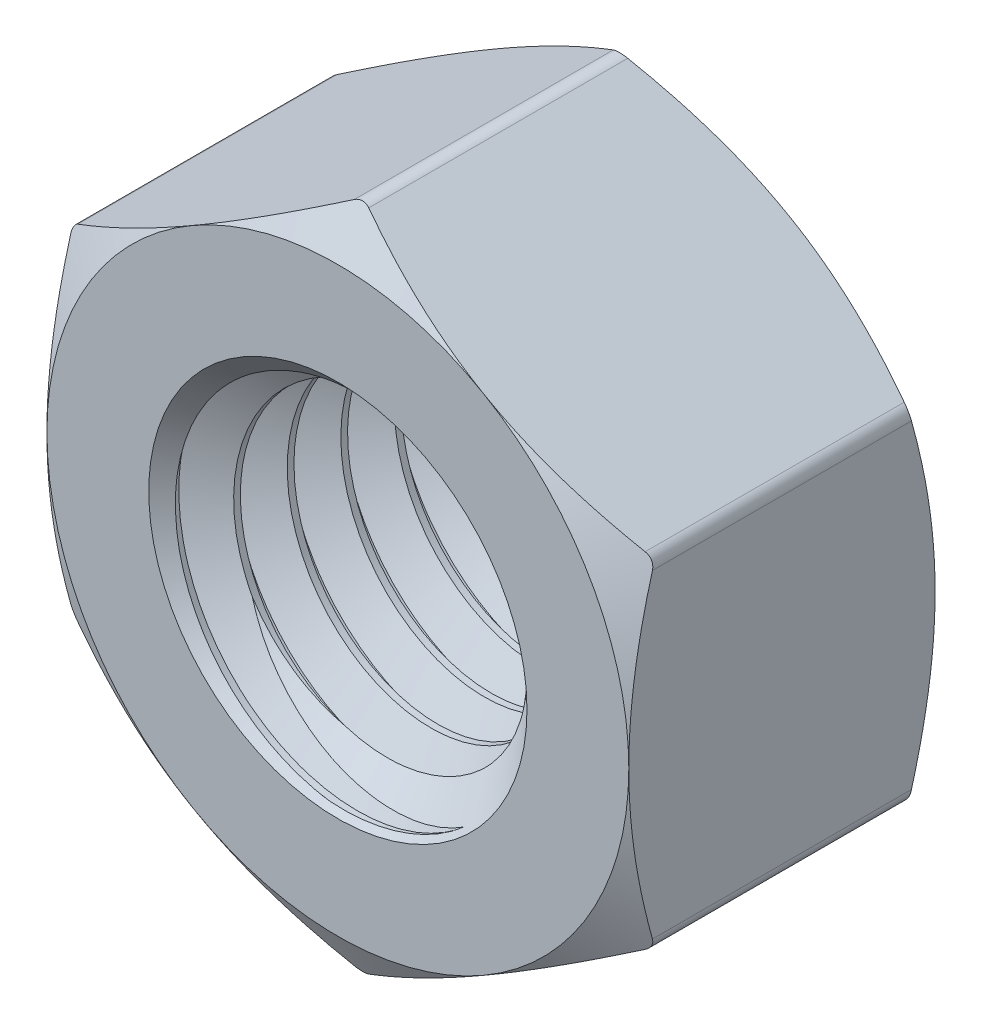
from build123d import *

# Parameters (mm, degrees)
BOSS_EXTRUDE2_DEPTH     = 5
CUT_EXTRUDE4_DEPTH      = 16.34872416
CUT_EXTRUDE4_DEPTH_BACK = 16.34872416
SKETCH16_R              = 6
SKETCH7_OUTSIDE_W       = 91.652
SKETCH7_OUTSIDE_H       = 94.592
SKETCH7_OUTSIDE_R       = 9.5
CUT_EXTRUDE5_DEPTH      = 18.62337463
CUT_EXTRUDE5_DRAFT      = -60
MIRROR4_COPY_1_SKETCH_W = 91.652
MIRROR4_COPY_1_SKETCH_H = 94.592
MIRROR4_COPY_1_SKETCH_R = 9.5
MIRROR4_COPY_1_DEPTH    = 18.62337463
MIRROR4_COPY_1_DRAFT    = -60
FILLET2_R               = 0.475
SKETCH13_R              = 6
BOSS_EXTRUDE1_DEPTH     = 10
CUT_SWEEP1_PITCH        = 1.75
SKETCH17_R              = 6
BOSS_EXTRUDE3_DEPTH     = 10


with BuildPart() as part:
    # Sketch15 → Boss-Extrude2 (new, symmetric)
    with BuildSketch(Plane.XY):
        Polygon((0, 10.969655115), (-9.5, 5.484827557), (-9.5, -5.484827557), (0, -10.969655115), (9.5, -5.484827557), (9.5, 5.484827557), align=None)
    extrude(amount=BOSS_EXTRUDE2_DEPTH, both=True)

    # Sketch16 → Cut-Extrude4 (cut, two sides: drawn at the far end of the back side and taken through both)
    with BuildSketch(Plane.XY.offset(-CUT_EXTRUDE4_DEPTH_BACK)):
        Circle(SKETCH16_R)
    extrude(amount=CUT_EXTRUDE4_DEPTH + CUT_EXTRUDE4_DEPTH_BACK, mode=Mode.SUBTRACT)


with BuildPart() as cut_extrude5_tool:
    # Sketch7 outside → Cut-Extrude5 (with draft: the straight prism first)
    with BuildSketch(Plane.XY.offset(5)):
        Rectangle(SKETCH7_OUTSIDE_W, SKETCH7_OUTSIDE_H)
        Circle(SKETCH7_OUTSIDE_R, mode=Mode.SUBTRACT)
    extrude(amount=-CUT_EXTRUDE5_DEPTH)
    # Cut-Extrude5: the draft: its side faces are tilted about the plane it starts from
    cut_extrude5_sides = [cut_extrude5_tool.faces().sort_by_distance(p)[0] for p in [
        (0, -47.296, -4.311687315),
        (45.826, 0, -4.311687315),
        (0, 47.296, -4.311687315),
        (-45.826, 0, -4.311687315),
        (-9.5, 0, -4.311687315),
    ]]
    draft(cut_extrude5_sides, Plane.XY.offset(5), CUT_EXTRUDE5_DRAFT)


with BuildPart() as part_1:
    add(part.part)

    # Cut-Extrude5: cut by cut_extrude5_tool
    add(cut_extrude5_tool.part, mode=Mode.SUBTRACT)


with BuildPart() as mirror4_copy_1_tool:
    # Mirror4 copy 1 sketch → Mirror4 copy 1 (with draft: the straight prism first)
    with BuildSketch(Plane(origin=(0, 0, -5), x_dir=(1, 0, 0), z_dir=(0, 0, -1))):
        Rectangle(MIRROR4_COPY_1_SKETCH_W, MIRROR4_COPY_1_SKETCH_H)
        Circle(MIRROR4_COPY_1_SKETCH_R, mode=Mode.SUBTRACT)
    extrude(amount=-MIRROR4_COPY_1_DEPTH)
    # Mirror4 copy 1: the draft: its side faces are tilted about the plane it starts from
    mirror4_copy_1_sides = [mirror4_copy_1_tool.faces().sort_by_distance(p)[0] for p in [
        (0, -47.296, 4.311687315),
        (45.826, 0, 4.311687315),
        (0, 47.296, 4.311687315),
        (-45.826, 0, 4.311687315),
        (-9.5, 0, 4.311687315),
    ]]
    draft(mirror4_copy_1_sides, Plane(origin=(0, 0, -5), x_dir=(1, 0, 0), z_dir=(0, 0, -1)), MIRROR4_COPY_1_DRAFT)


with BuildPart() as part_2:
    add(part_1.part)

    # Mirror4 copy 1: cut by mirror4_copy_1_tool
    add(mirror4_copy_1_tool.part, mode=Mode.SUBTRACT)

    # Fillet2
    fillet2_edges = [part_2.edges().sort_by_distance(p)[0] for p in [
        (-9.5, 5.484827557, 0),
        (-9.5, -5.484827557, 0),
        (0, -10.969655115, 0),
        (9.5, -5.484827557, 0),
        (9.5, 5.484827557, 0),
        (0, 10.969655115, 0),
    ]]
    fillet(fillet2_edges, radius=FILLET2_R)

    # Sketch17 → Boss-Extrude3 (add)
    with BuildSketch(Plane.XY.offset(5)):
        Circle(SKETCH17_R)
    extrude(amount=-BOSS_EXTRUDE3_DEPTH)


with BuildPart() as body_2:
    # Sketch13 → Boss-Extrude1 (new body)
    with BuildSketch(Plane(origin=(0, 0, -5), x_dir=(-1, 0, 0), z_dir=(0, 0, -1))):
        Circle(SKETCH13_R)
    extrude(amount=-BOSS_EXTRUDE1_DEPTH)

    # Cut-Sweep1: the profile of Sketch12 profile screwed along a right-hand helix of 7.714286 turns, 10 arcs to a turn; built about Z, then put on its axis
    cut_sweep1_z = Axis((0, 0, 0), (0, 0, 1))
    cut_sweep1_corners = [(6.0003, 0, -1.531423205), (6.0003, 0, 0.000173205), (4.863341658, 0, -0.65625), (4.863341658, 0, -0.875)]
    with BuildLine(mode=Mode.PRIVATE) as cut_sweep1_profile:
        Line(cut_sweep1_corners[0], cut_sweep1_corners[1])
        Line(cut_sweep1_corners[1], cut_sweep1_corners[2])
        Line(cut_sweep1_corners[2], cut_sweep1_corners[3])
        Line(cut_sweep1_corners[3], cut_sweep1_corners[0])
    cut_sweep1_cap = Face(cut_sweep1_profile.wire())
    cut_sweep1_turn_angles = [0, 18, 36, 54, 72, 90, 108, 126, 144, 162, 180, 198, 216, 234, 252, 270, 288, 306, 324, 342, 360]
    cut_sweep1_turn_weights = [1, 0.9510565162951535, 1, 0.9510565162951535, 1, 0.9510565162951535, 1, 0.9510565162951535, 1, 0.9510565162951535, 1, 0.9510565162951535, 1, 0.9510565162951535, 1, 0.9510565162951535, 1, 0.9510565162951535, 1, 0.9510565162951535, 1]
    cut_sweep1_turn_rails = [Edge.make_bspline([Vector(p[0], p[1], 0).rotate(cut_sweep1_z, cut_sweep1_turn_angles[k]) / cut_sweep1_turn_weights[k] + Vector(0, 0, p[2] + CUT_SWEEP1_PITCH * cut_sweep1_turn_angles[k] / 360) for k in range(21)], [0, 0, 0, 1, 1, 2, 2, 3, 3, 4, 4, 5, 5, 6, 6, 7, 7, 8, 8, 9, 9, 10, 10, 10], 2, cut_sweep1_turn_weights) for p in cut_sweep1_corners]
    cut_sweep1_turn_sides = [Face.make_surface_from_curves(cut_sweep1_turn_rails[p[0]], cut_sweep1_turn_rails[p[1]]) for p in [(0, 1), (1, 2), (2, 3), (3, 0)]]
    cut_sweep1_last_angles = [2520, 2538, 2556, 2574, 2592, 2610, 2628, 2646, 2664, 2682, 2700, 2718, 2736, 2754, 2772, 2774.571428571, 2777.142857143]
    cut_sweep1_last_weights = [1, 0.9510565162951535, 1, 0.9510565162951535, 1, 0.9510565162951535, 1, 0.9510565162951535, 1, 0.9510565162951535, 1, 0.9510565162951535, 1, 0.9510565162951535, 1, 0.9989930665413137, 1]
    cut_sweep1_last_rails = [Edge.make_bspline([Vector(p[0], p[1], 0).rotate(cut_sweep1_z, cut_sweep1_last_angles[k]) / cut_sweep1_last_weights[k] + Vector(0, 0, p[2] + CUT_SWEEP1_PITCH * cut_sweep1_last_angles[k] / 360) for k in range(17)], [0, 0, 0, 1, 1, 2, 2, 3, 3, 4, 4, 5, 5, 6, 6, 7, 7, 8, 8, 8], 2, cut_sweep1_last_weights) for p in cut_sweep1_corners]
    cut_sweep1_last_sides = [Face.make_surface_from_curves(cut_sweep1_last_rails[p[0]], cut_sweep1_last_rails[p[1]]) for p in [(0, 1), (1, 2), (2, 3), (3, 0)]]
    cut_sweep1 = Plane(origin=(0, 0, -5), x_dir=(0, 1, 0), z_dir=(0, 0, 1)) * Solid(Shell([*[p.moved(Location((0, 0, CUT_SWEEP1_PITCH * i))) for i in range(7) for p in cut_sweep1_turn_sides], *cut_sweep1_last_sides, cut_sweep1_cap, cut_sweep1_cap.rotate(cut_sweep1_z, 2777.142857143).moved(Location((0, 0, CUT_SWEEP1_PITCH * 2777.142857143 / 360)))]))
    add(cut_sweep1, mode=Mode.SUBTRACT)


with BuildPart() as part_3:
    add(part_2.part)

    # Combine1: cut body 2
    add(body_2.part, mode=Mode.SUBTRACT)

    # Cut-Extrude2 cone 1 section (through the dimple's axis) → Cut-Extrude2 (revolve, cut)
    with BuildSketch(Plane(origin=(0, 0, 5), x_dir=(0, -1, 0), z_dir=(1, 0, 0))):
        Polygon((0, 0), (6.175, 0), (0, 6.175), align=None)
    revolve(axis=Axis((0, 0, 5), (0, 0, -1)), mode=Mode.SUBTRACT)

    # Cut-Extrude3 cone 1 section (through the dimple's axis) → Cut-Extrude3 (revolve, cut)
    with BuildSketch(Plane(origin=(0, 0, -5), x_dir=(0, 1, 0), z_dir=(1, 0, 0))):
        Polygon((0, 0), (6.175, 0), (0, 6.175), align=None)
    revolve(axis=Axis((0, 0, -5), (0, 0, 1)), mode=Mode.SUBTRACT)


solid = part_3.part
